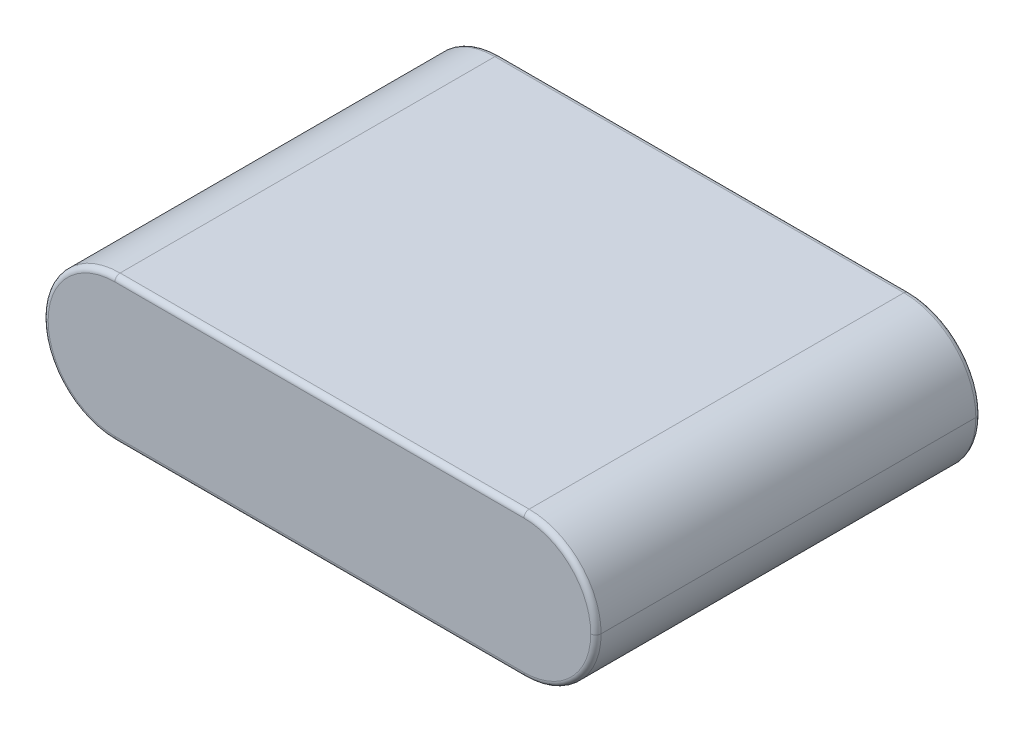
from build123d import *

# Parameters (mm, degrees)
ESQUISSE1_W        = 106.4
ESQUISSE1_H        = 74.1
BOSS_EXTRU_1_DEPTH = 27.7
CONG_2_R           = 13.85
CONG_3_R           = 1


with BuildPart() as part:
    # Esquisse1 → Boss.-Extru.1 (new body)
    with BuildSketch(Plane(origin=(0, 0, 0), x_dir=(1, 0, 0), z_dir=(0, 1, 0))):
        with Locations((53.2, 37.05)):
            Rectangle(ESQUISSE1_W, ESQUISSE1_H)
    extrude(amount=BOSS_EXTRU_1_DEPTH)

    # Congé2
    cong_2_edges = [part.edges().sort_by_distance(p)[0] for p in [
        (0, 0, -37.05),
        (0, 27.7, -37.05),
        (106.4, 27.7, -37.05),
        (106.4, 0, -37.05),
    ]]
    fillet(cong_2_edges, radius=CONG_2_R - 0.0001)  # a hair under: the kernel refuses the full size

    # Congé3
    cong_3_edges = [part.edges().sort_by_distance(p)[0] for p in [
        (53.2, 0, 0),
        (53.2, 27.7, 0),
        (102.343458209, 4.056541791, 0),
        (102.343458209, 23.643458209, 0),
        (4.056541791, 23.643458209, 0),
        (4.056541791, 4.056541791, 0),
        (53.2, 0, -74.1),
        (53.2, 27.7, -74.1),
        (102.343458209, 4.056541791, -74.1),
        (102.343458209, 23.643458209, -74.1),
        (4.056541791, 23.643458209, -74.1),
        (4.056541791, 4.056541791, -74.1),
    ]]
    fillet(cong_3_edges, radius=CONG_3_R)


solid = part.part
